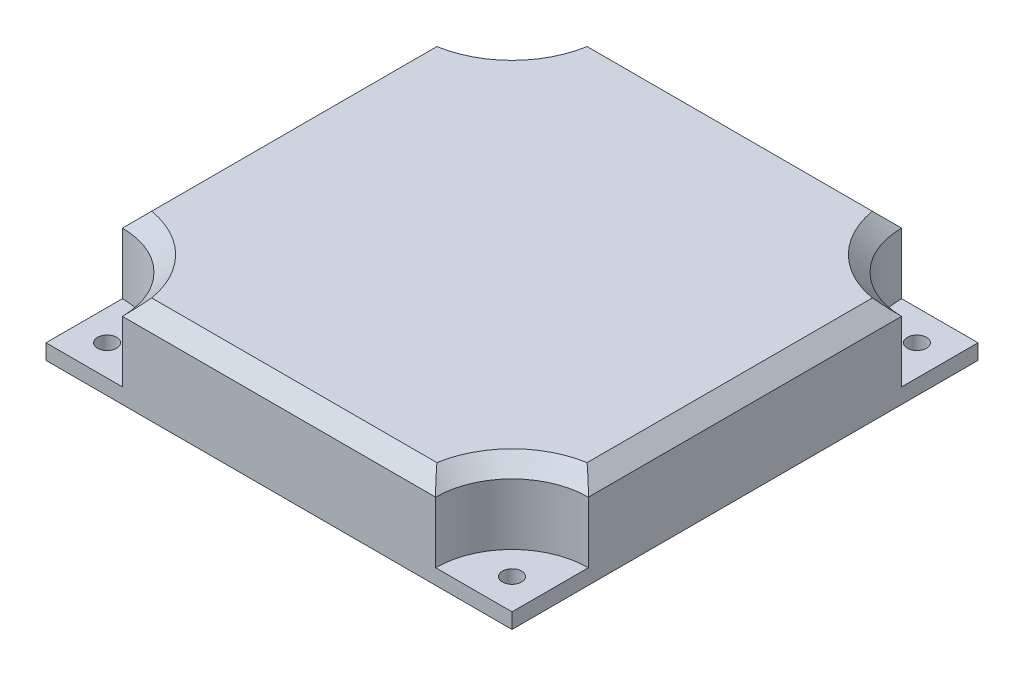
from build123d import *

# Parameters (mm, degrees)
SKETCH2_W           = 61
SKETCH2_H           = 61
BOSS_EXTRUDE1_DEPTH = 12
SKETCH4_R           = 10
CUT_EXTRUDE3_DEPTH  = 10
CUT_EXTRUDE5_DEPTH  = 10
FILLET2_SIZE        = 2
FILLET3_R           = 5


with BuildPart() as part:
    # Sketch2 → Boss-Extrude1 (new body)
    with BuildSketch(Plane(origin=(0, 0, 0), x_dir=(1, 0, 0), z_dir=(0, 1, 0))):
        Rectangle(SKETCH2_W, SKETCH2_H)
    extrude(amount=BOSS_EXTRUDE1_DEPTH)

    # Sketch4 → Cut-Extrude3 (cut)
    with BuildSketch(Plane(origin=(0, 12, 0), x_dir=(1, 0, 0), z_dir=(0, 1, 0))):
        with Locations((30.5, -30.5)):
            Circle(SKETCH4_R)
        with Locations((-30.5, -30.5)):
            Circle(SKETCH4_R)
        with Locations((-30.5, 30.5)):
            Circle(SKETCH4_R)
        with Locations((30.5, 30.5)):
            Circle(SKETCH4_R)
    extrude(amount=-CUT_EXTRUDE3_DEPTH, mode=Mode.SUBTRACT)

    # Sketch8 → Cut-Extrude5 (cut)
    with BuildSketch(Plane.XZ):
        with BuildLine():
            Line((-18.667840434, -28.5), (18.667840434, -28.5))
            ThreePointArc((18.667840434, -28.5), (22.014718626, -22.014718626), (28.5, -18.667840434))
            Line((28.5, -18.667840434), (28.5, 18.667840434))
            ThreePointArc((28.5, 18.667840434), (22.014718626, 22.014718626), (18.667840434, 28.5))
            Line((18.667840434, 28.5), (-18.667840434, 28.5))
            ThreePointArc((-18.667840434, 28.5), (-22.014718626, 22.014718626), (-28.5, 18.667840434))
            Line((-28.5, 18.667840434), (-28.5, -18.667840434))
            ThreePointArc((-28.5, -18.667840434), (-22.014718626, -22.014718626), (-18.667840434, -28.5))
        make_face()
    extrude(amount=-CUT_EXTRUDE5_DEPTH, mode=Mode.SUBTRACT)

    # Fillet2
    fillet2_edges = [part.edges().sort_by_distance(p)[0] for p in [
        (30.5, 12, 0),
        (23.428932188, 12, 23.428932188),
        (0, 12, 30.5),
        (-23.428932188, 12, 23.428932188),
        (-30.5, 12, 0),
        (-23.428932188, 12, -23.428932188),
        (0, 12, -30.5),
        (23.428932188, 12, -23.428932188),
    ]]
    chamfer(fillet2_edges, length=FILLET2_SIZE)

    # Sketch15 → M3x0.5 Tapped Hole1 (revolve, cut)
    with BuildSketch(Plane(origin=(26.5, 2, 26.5), x_dir=(0, 0, 1), z_dir=(1, 0, 0))):
        Polygon((0, 0), (0, 8.251075774), (1.25, 7.5), (1.25, 0), align=None)
    m3x0_5_tapped_hole1 = revolve(axis=Axis((26.5, 8.35, 26.5), (0, -1, 0)), mode=Mode.SUBTRACT)

    # Mirror1: M3x0.5 Tapped Hole1 across plane
    add(m3x0_5_tapped_hole1.mirror(Plane.XY), mode=Mode.SUBTRACT)

    # Mirror2: M3x0.5 Tapped Hole1 across plane
    add(m3x0_5_tapped_hole1.mirror(Plane(origin=(0, 0, 0), x_dir=(0, 0, 1), z_dir=(1, 0, 0))), mode=Mode.SUBTRACT)

    # Mirror2 copy 1 sketch → Mirror2 copy 1 (revolve, cut)
    with BuildSketch(Plane(origin=(-26.5, 2, -26.5), x_dir=(0, 0, -1), z_dir=(-1, 0, 0))):
        Polygon((0, 0), (0, 8.251075774), (1.25, 7.5), (1.25, 0), align=None)
    revolve(axis=Axis((-26.5, 8.35, -26.5), (0, -1, 0)), mode=Mode.SUBTRACT)

    # Fillet3
    fillet3_edges = [part.edges().sort_by_distance(p)[0] for p in [
        (18.667840434, 5, -28.5),
        (28.5, 5, -18.667840434),
        (28.5, 5, 18.667840434),
        (18.667840434, 5, 28.5),
        (-18.667840434, 5, 28.5),
        (-28.5, 5, 18.667840434),
        (-18.667840434, 5, -28.5),
        (-28.5, 5, -18.667840434),
    ]]
    fillet(fillet3_edges, radius=FILLET3_R)


solid = part.part
